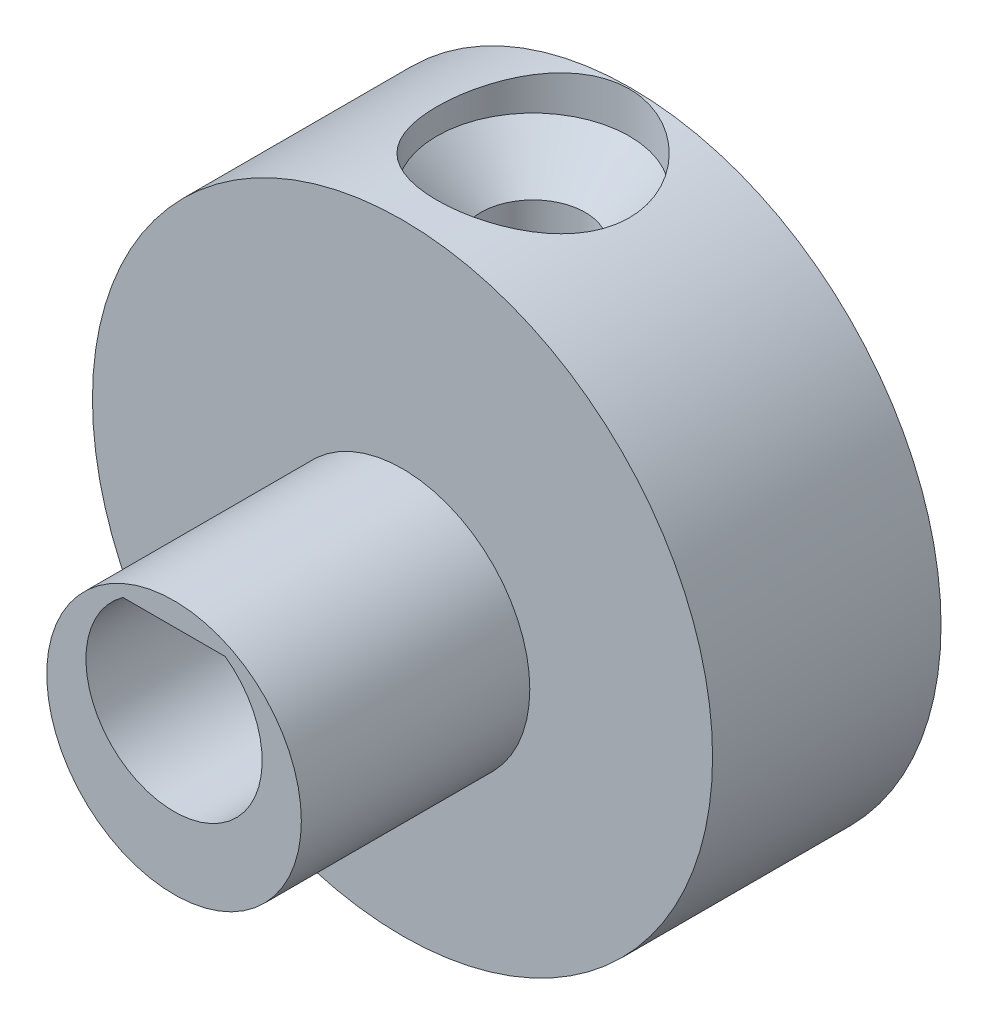
from build123d import *

# Parameters (mm, degrees)
ESQUISSE1_R                         = 9.5
BOSS_EXTRU_1_DEPTH                  = 7
ESQUISSE2_W                         = 5.8
ESQUISSE2_H                         = 2.4
ENL_V_MAT_EXTRU_1_DEPTH             = 6
ENL_V_MAT_EXTRU_2_REACH             = 19.336
ESQUISSE3_R                         = 1.6
ENL_V_MAT_EXTRU_2_DIRECTION_2_REACH = 19.336
ESQUISSE7_R                         = 2.95
ENL_V_MAT_EXTRU_8_DEPTH             = 22.858865638
CHANFREIN1_SIZE                     = 2
ESQUISSE9_R                         = 3.9
BOSS_EXTRU_2_DEPTH                  = 7


with BuildPart() as part:
    # Esquisse1 → Boss.-Extru.1 (new body)
    with BuildSketch(Plane.XY):
        Circle(ESQUISSE1_R)
        with BuildLine():
            Line((-1.565247584, 2.2), (1.565247584, 2.2))
            ThreePointArc((1.565247584, 2.2), (0, -2.7), (-1.565247584, 2.2))
        make_face(mode=Mode.SUBTRACT)
    extrude(amount=BOSS_EXTRU_1_DEPTH)

    # Esquisse2 → Enlèv. mat.-Extru.1 (cut)
    with BuildSketch(Plane(origin=(0, 0, 0), x_dir=(-1, 0, 0), z_dir=(0, 0, -1))):
        with Locations((0, 4.4)):
            Rectangle(ESQUISSE2_W, ESQUISSE2_H)
    extrude(amount=-ENL_V_MAT_EXTRU_1_DEPTH, mode=Mode.SUBTRACT)

    # Esquisse3 → Enlèv. mat.-Extru.2 (cut, up to next)
    with BuildSketch(Plane(origin=(0, 3.2, 0), x_dir=(1, 0, 0), z_dir=(0, 1, 0)), mode=Mode.PRIVATE) as enl_v_mat_extru_2_sk1:
        with Locations(Location((0, -3, 0), (0, 0, 90))):
            Circle(ESQUISSE3_R)
    enl_v_mat_extru_2_tool1 = extrude(enl_v_mat_extru_2_sk1.sketch, amount=-ENL_V_MAT_EXTRU_2_REACH, mode=Mode.PRIVATE) & part.part
    add(enl_v_mat_extru_2_tool1.solids().sort_by_distance((0, 3.2, 3))[0], mode=Mode.SUBTRACT)

    # Esquisse3 → Enlèv. mat.-Extru.2 direction 2 (cut, up to next)
    with BuildSketch(Plane(origin=(0, 3.2, 0), x_dir=(1, 0, 0), z_dir=(0, 1, 0)), mode=Mode.PRIVATE) as enl_v_mat_extru_2_direction_2_sk1:
        with Locations(Location((0, -3, 0), (0, 0, 90))):
            Circle(ESQUISSE3_R)
    enl_v_mat_extru_2_direction_2_tool1 = extrude(enl_v_mat_extru_2_direction_2_sk1.sketch, amount=ENL_V_MAT_EXTRU_2_DIRECTION_2_REACH, mode=Mode.PRIVATE) & part.part
    add(enl_v_mat_extru_2_direction_2_tool1.solids().sort_by_distance((0, 3.2, 3))[0], mode=Mode.SUBTRACT)

    # Esquisse7 → Enlèv. mat.-Extru.8 (cut, through all)
    with BuildSketch(Plane(origin=(0, 8.9, 0), x_dir=(1, 0, 0), z_dir=(0, 1, 0))):
        with Locations(Location((0, -3, 0), (0, 0, 90))):
            Circle(ESQUISSE7_R)
    extrude(amount=ENL_V_MAT_EXTRU_8_DEPTH, mode=Mode.SUBTRACT)

    # Chanfrein1
    # the kernel refuses this chamfer: 2 mm, written as the material it takes off along each edge
    with BuildSketch(Plane(origin=(0, 8.9, 3), x_dir=(0, 0, -1), z_dir=(-1, 0, 0))) as chanfrein1_piece_1_section:
        Polygon((1.6 + CHANFREIN1_SIZE, 0), (1.6, CHANFREIN1_SIZE), (1.6, 0), align=None)
    chanfrein1_piece_1 = revolve(axis=Axis((0, 8.9, 3), (0, -1, 0)), mode=Mode.PRIVATE)
    chanfrein1_piece_1 = chanfrein1_piece_1 & Plane(origin=(0, 7.567667742, 3), x_dir=(0, 0, -1), z_dir=(0, -1, 0)) * Cylinder(2.95, 15, mode=Mode.PRIVATE)
    add(chanfrein1_piece_1, mode=Mode.SUBTRACT)

    # Esquisse9 → Boss.-Extru.2 (add)
    with BuildSketch(Plane.XY.offset(7)):
        with Locations((0, -1)):
            Circle(ESQUISSE9_R)
        with BuildLine():
            Line((-1.565247584, 2.2), (1.565247584, 2.2))
            ThreePointArc((1.565247584, 2.2), (0, -2.7), (-1.565247584, 2.2))
        make_face(mode=Mode.SUBTRACT)
    extrude(amount=BOSS_EXTRU_2_DEPTH)


solid = part.part
